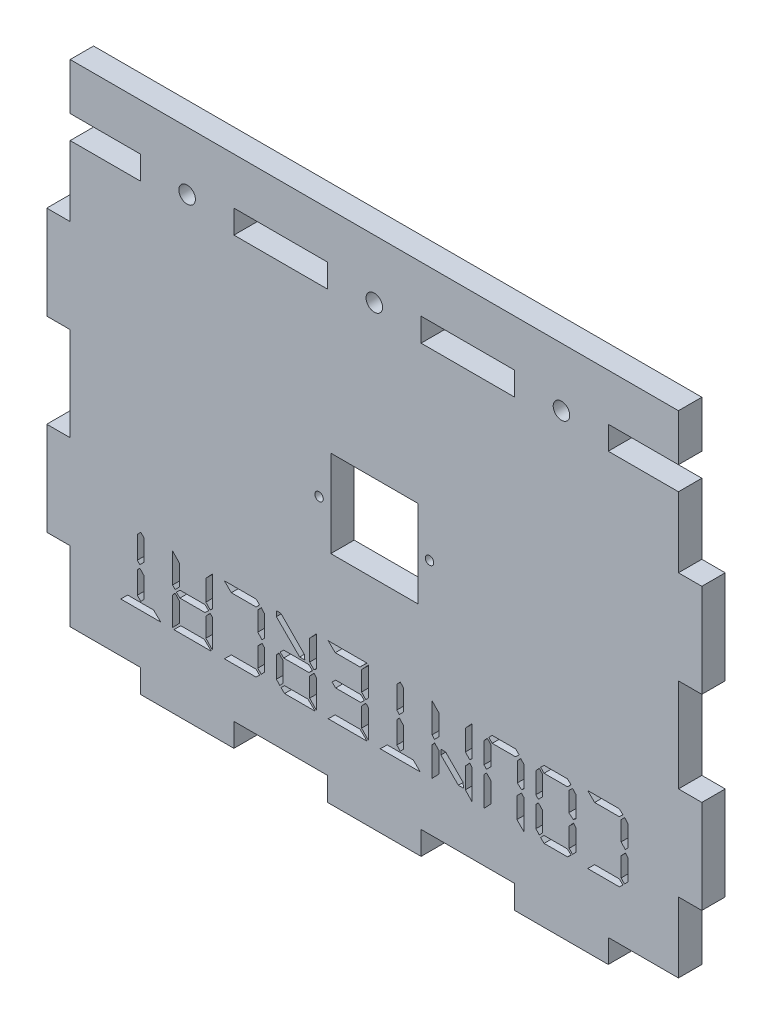
from build123d import *

# Parameters (mm, degrees)
SKETCH1_W                 = 177.8
SKETCH1_H                 = 139.7
BOSS_EXTRUDE1_DEPTH       = 6.35
SKETCH5_W                 = 6.35
SKETCH5_H                 = 25.4
CUT_EXTRUDE4_DEPTH        = 6.35
SKETCH6_W                 = 25.4
SKETCH6_H                 = 6.35
CUT_EXTRUDE5_DEPTH        = 6.35
LPATTERN5_COUNT           = 3
LPATTERN5_PITCH           = 50.8
LPATTERN5_COUNT_DIR2      = 2
LPATTERN5_PITCH_DIR2      = 171.45
LPATTERN6_COUNT           = 4
LPATTERN6_PITCH           = 50.8
LPATTERN6_COUNT_DIR2      = 2
LPATTERN6_PITCH_DIR2      = 120.65
SKETCH7_W                 = 6.35
SKETCH7_H                 = 19.05
CUT_EXTRUDE6_DEPTH        = 6.35
SKETCH12_W                = 6.35
SKETCH12_H                = 12.7
CUT_EXTRUDE9_DEPTH        = 7.62
F_8_CLEARANCE_HOLE1_D     = 4.4958
F_8_CLEARANCE_HOLE1_DEPTH = 10.16
F_8_CLEARANCE_HOLE1_TIP   = 1.350674586
SKETCH11_R                = 1.143
SKETCH11_W                = 23.622
SKETCH11_H                = 23.622
CUT_EXTRUDE8_DEPTH        = 7.62
CUT_EXTRUDE10_DEPTH       = 10.16


with BuildPart() as part:
    # Sketch1 → Boss-Extrude1 (new body)
    with BuildSketch(Plane.XY):
        with Locations((88.9, 69.85)):
            Rectangle(SKETCH1_W, SKETCH1_H)
    extrude(amount=BOSS_EXTRUDE1_DEPTH)

    # Sketch5 → Cut-Extrude4 (cut)
    with BuildSketch(Plane.XY.offset(6.35)):
        with Locations((3.175, 12.7)):
            Rectangle(SKETCH5_W, SKETCH5_H)
    cut_extrude4 = extrude(amount=-CUT_EXTRUDE4_DEPTH, mode=Mode.SUBTRACT)

    # Sketch6 → Cut-Extrude5 (cut)
    with BuildSketch(Plane.XY.offset(6.35)):
        with Locations((12.7, 3.175)):
            Rectangle(SKETCH6_W, SKETCH6_H)
    cut_extrude5 = extrude(amount=-CUT_EXTRUDE5_DEPTH, mode=Mode.SUBTRACT)

    # LPattern5: Cut-Extrude4 3 × 2
    with Locations(*[(j * LPATTERN5_PITCH_DIR2, i * LPATTERN5_PITCH, 0) for i in range(LPATTERN5_COUNT) for j in range(LPATTERN5_COUNT_DIR2) if (i, j) != (0, 0)]):
        add(cut_extrude4, mode=Mode.SUBTRACT)

    # LPattern6: Cut-Extrude5 4 × 2
    with Locations(*[(i * LPATTERN6_PITCH, j * LPATTERN6_PITCH_DIR2, 0) for i in range(LPATTERN6_COUNT) for j in range(LPATTERN6_COUNT_DIR2) if (i, j) != (0, 0)]):
        add(cut_extrude5, mode=Mode.SUBTRACT)

    # Sketch7 → Cut-Extrude6 (cut)
    with BuildSketch(Plane.XY.offset(6.35)):
        with Locations((3.175, 130.175)):
            Rectangle(SKETCH7_W, SKETCH7_H)
    extrude(amount=-CUT_EXTRUDE6_DEPTH, mode=Mode.SUBTRACT)

    # Sketch12 → Cut-Extrude9 (cut)
    with BuildSketch(Plane.XY.offset(6.35)):
        with Locations((174.625, 133.35)):
            Rectangle(SKETCH12_W, SKETCH12_H)
    extrude(amount=-CUT_EXTRUDE9_DEPTH, mode=Mode.SUBTRACT)

    # #8 Clearance Hole1
    with Locations(Plane.XY.offset(6.35)):
        with Locations((38.1, 123.825), (88.9, 123.825), (139.7, 123.825)):
            Hole(F_8_CLEARANCE_HOLE1_D / 2, depth=F_8_CLEARANCE_HOLE1_DEPTH)
            with Locations((0, 0, -(F_8_CLEARANCE_HOLE1_DEPTH + F_8_CLEARANCE_HOLE1_TIP / 2))):  # 118° drill point
                Cone(0, F_8_CLEARANCE_HOLE1_D / 2, F_8_CLEARANCE_HOLE1_TIP, mode=Mode.SUBTRACT)

    # Sketch11 → Cut-Extrude8 (cut)
    with BuildSketch(Plane.XY.offset(6.35)):
        with Locations((73.914, 70.739)):
            Circle(SKETCH11_R)
        with Locations((103.886, 70.739)):
            Circle(SKETCH11_R)
        with Locations((88.9, 70.739)):
            Rectangle(SKETCH11_W, SKETCH11_H)
    extrude(amount=-CUT_EXTRUDE8_DEPTH, mode=Mode.SUBTRACT)

    # Sketch14 → Cut-Extrude10 (cut)
    with BuildSketch(Plane.XY.offset(6.35)):
        Polygon((20.059189012, 19.760170046), (21.98204709, 21.620732505), (29.004839765, 21.620732505), (30.95676913, 19.760170046), align=None)
        Polygon((24.577697842, 37.2029431), (25.520438195, 38.166448659), (26.438260301, 37.2029431), (26.438260301, 31.61294964), (25.271255723, 30.391955526), (24.577697842, 31.118737737), align=None)
        Polygon((24.577697842, 28.863636364), (25.271255723, 29.594571615), (26.438260301, 28.344506213), (26.438260301, 22.891563113), (25.520438195, 21.886527142), (24.577697842, 22.891563113), align=None)
        Polygon((34.474395029, 19.760170046), (36.405559189, 21.620732505), (42.747253107, 21.620732505), (44.678417266, 19.760170046), align=None)
        Polygon((43.183322433, 30.566383257), (43.183322433, 36.193754088), (45.043884892, 38.166448659), (45.043884892, 29.860366252), (44.350327011, 29.328776978), align=None)
        Polygon((45.043884892, 27.800457816), (45.043884892, 20.125637672), (43.183322433, 22.08587312), (43.183322433, 27.302092871), (44.350327011, 28.531393067), align=None)
        Polygon((34.146304774, 30.084630477), (34.146304774, 38.1), (36.006867233, 36.143917593), (36.006867233, 30.553924133), (34.823250491, 29.328776978), align=None)
        Polygon((36.006867233, 27.235644212), (36.006867233, 22.01942446), (34.146304774, 20.059189012), (34.146304774, 27.734009156), (34.823250491, 28.531393067), align=None)
        Polygon((36.143917593, 27.999803793), (35.151340746, 28.930085023), (36.143917593, 29.860366252), (42.954905167, 29.860366252), (43.947482014, 28.930085023), (42.954905167, 27.999803793), align=None)
        Polygon((48.196043165, 19.760170046), (50.098136037, 21.620732505), (56.80529758, 21.620732505), (57.772956181, 20.677992152), (56.80529758, 19.760170046), align=None)
        Polygon((57.270438195, 27.302092871), (58.437442773, 28.531393067), (59.131000654, 27.800457816), (59.131000654, 22.08587312), (58.213178548, 21.093296272), (57.270438195, 22.08587312), align=None)
        Polygon((48.196043165, 38.1), (56.80529758, 38.1), (57.772956181, 37.182177894), (56.80529758, 36.239437541), (50.098136037, 36.239437541), align=None)
        Polygon((57.270438195, 35.778449967), (58.213178548, 36.771026815), (59.131000654, 35.778449967), (59.131000654, 30.084630477), (58.437442773, 29.328776978), (57.270438195, 30.558077175), align=None)
        Polygon((62.320536298, 27.734009156), (62.997482014, 28.531393067), (64.181098757, 27.235644212), (64.181098757, 22.01942446), (63.250817528, 21.026847613), (62.320536298, 22.01942446), align=None)
        Polygon((63.587213865, 20.677992152), (64.550719424, 21.620732505), (70.892413342, 21.620732505), (72.85264879, 19.760170046), (64.550719424, 19.760170046), align=None)
        Polygon((71.357553957, 27.302092871), (72.524558535, 28.531393067), (73.218116416, 27.800457816), (73.218116416, 20.125637672), (71.357553957, 22.08587312), align=None)
        Polygon((71.357553957, 36.193754088), (73.218116416, 38.166448659), (73.218116416, 29.860366252), (72.524558535, 29.328776978), (71.357553957, 30.566383257), align=None)
        Polygon((69.891530412, 31.6793983), (70.028580772, 30.391955526), (68.633158927, 30.391955526), (62.320536298, 36.717037279), (62.320536298, 38.166448659), (63.583060824, 38.083387835), align=None)
        Polygon((64.318149117, 27.999803793), (63.325572269, 28.930085023), (64.318149117, 29.860366252), (71.129136691, 29.860366252), (72.121713538, 28.930085023), (71.129136691, 27.999803793), align=None)
        Polygon((76.370274689, 19.760170046), (78.301438849, 21.620732505), (85.008600392, 21.620732505), (86.939764552, 19.760170046), align=None)
        Polygon((76.370274689, 38.1), (86.939764552, 38.1), (85.008600392, 36.239437541), (78.301438849, 36.239437541), align=None)
        Polygon((85.444669719, 30.570536298), (85.444669719, 35.853204709), (87.305232178, 37.834205363), (87.305232178, 30.09293656), (86.611674297, 29.328776978), align=None)
        Polygon((87.305232178, 27.800457816), (87.305232178, 20.125637672), (85.444669719, 22.08587312), (85.444669719, 27.302092871), (86.611674297, 28.531393067), align=None)
        Polygon((78.405264879, 27.999803793), (77.412688031, 28.930085023), (78.405264879, 29.860366252), (85.216252453, 29.860366252), (86.2088293, 28.930085023), (85.216252453, 27.999803793), align=None)
        Polygon((90.494767822, 19.760170046), (92.417625899, 21.620732505), (99.440418574, 21.620732505), (101.39234794, 19.760170046), align=None)
        Polygon((95.013276651, 37.2029431), (95.956017005, 38.166448659), (96.873839111, 37.2029431), (96.873839111, 31.61294964), (95.706834532, 30.391955526), (95.013276651, 31.118737737), align=None)
        Polygon((95.013276651, 28.863636364), (95.706834532, 29.594571615), (96.873839111, 28.344506213), (96.873839111, 22.891563113), (95.956017005, 21.886527142), (95.013276651, 22.891563113), align=None)
        Polygon((113.618901243, 30.566383257), (113.618901243, 36.193754088), (115.479463702, 38.166448659), (115.479463702, 29.860366252), (114.785905821, 29.328776978), align=None)
        Polygon((115.479463702, 27.796304774), (115.479463702, 19.693721387), (113.618901243, 21.666415958), (113.618901243, 27.293786789), (114.785905821, 28.531393067), align=None)
        Polygon((104.581883584, 30.084630477), (104.581883584, 38.1), (106.442446043, 36.143917593), (106.442446043, 30.553924133), (105.2588293, 29.328776978), align=None)
        Polygon((106.442446043, 27.314551995), (106.442446043, 21.774395029), (104.581883584, 19.830771746), (104.581883584, 27.734009156), (105.2588293, 28.531393067), align=None)
        Polygon((113.000098103, 23.115827338), (113.087311969, 21.791007194), (111.708502289, 21.791007194), (106.974035317, 26.53793329), (106.974035317, 27.92089601), (108.273937214, 27.866906475), align=None)
        Polygon((118.668999346, 35.778449967), (119.599280576, 36.771026815), (120.529561805, 35.778449967), (120.529561805, 30.558077175), (119.345945062, 29.328776978), (118.668999346, 30.084630477), align=None)
        Polygon((129.566579464, 35.550032701), (128.648757358, 36.542609549), (127.706017005, 35.550032701), (127.706017005, 30.329659908), (128.873021583, 29.33293002), (129.566579464, 29.860366252), align=None)
        Polygon((127.24087639, 38.1), (128.20853499, 37.182177894), (127.24087639, 36.239437541), (120.899182472, 36.239437541), (119.964748201, 37.182177894), (120.899182472, 38.1), align=None)
        Polygon((129.566579464, 27.734009156), (129.566579464, 19.693721387), (127.610497057, 21.666415958), (127.610497057, 27.293786789), (128.835644212, 28.531393067), align=None)
        Polygon((120.529561805, 27.314551995), (120.529561805, 21.774395029), (118.668999346, 19.830771746), (118.668999346, 27.804610857), (119.345945062, 28.531393067), align=None)
        Polygon((132.756115108, 27.800457816), (133.433060824, 28.531393067), (134.616677567, 27.302092871), (134.616677567, 22.08587312), (133.686396337, 21.093296272), (132.756115108, 22.08587312), align=None)
        Polygon((134.022792675, 20.677992152), (134.986298234, 21.620732505), (141.327992152, 21.620732505), (142.324722041, 20.677992152), (141.327992152, 19.760170046), (134.986298234, 19.760170046), align=None)
        Polygon((132.756115108, 35.778449967), (133.686396337, 36.771026815), (134.616677567, 35.778449967), (134.616677567, 30.558077175), (133.433060824, 29.328776978), (132.756115108, 30.084630477), align=None)
        Polygon((141.793132767, 27.235644212), (142.960137345, 28.531393067), (143.653695226, 27.734009156), (143.653695226, 22.01942446), (142.73587312, 21.026847613), (141.793132767, 22.01942446), align=None)
        Polygon((143.653695226, 35.550032701), (142.690189666, 36.542609549), (141.697612819, 35.550032701), (141.697612819, 30.329659908), (142.922759974, 29.33293002), (143.653695226, 29.860366252), align=None)
        Polygon((141.327992152, 38.1), (142.295650752, 37.182177894), (141.327992152, 36.239437541), (134.986298234, 36.239437541), (134.051863963, 37.182177894), (134.986298234, 38.1), align=None)
        Polygon((146.805853499, 19.760170046), (148.70794637, 21.620732505), (155.415107914, 21.620732505), (156.382766514, 20.677992152), (155.415107914, 19.760170046), align=None)
        Polygon((155.880248528, 27.302092871), (157.047253107, 28.531393067), (157.740810988, 27.800457816), (157.740810988, 22.08587312), (156.822988882, 21.093296272), (155.880248528, 22.08587312), align=None)
        Polygon((146.805853499, 38.1), (155.415107914, 38.1), (156.382766514, 37.182177894), (155.415107914, 36.239437541), (148.70794637, 36.239437541), align=None)
        Polygon((155.880248528, 35.778449967), (156.822988882, 36.771026815), (157.740810988, 35.778449967), (157.740810988, 30.084630477), (157.047253107, 29.328776978), (155.880248528, 30.558077175), align=None)
    extrude(amount=-CUT_EXTRUDE10_DEPTH, mode=Mode.SUBTRACT)


solid = part.part
